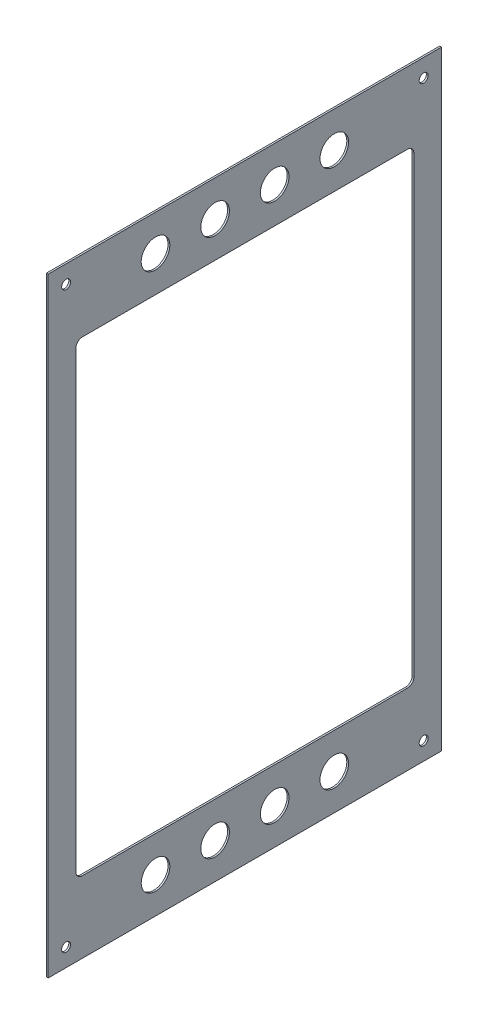
from build123d import *

# Parameters (mm, degrees)
SKETCH1_W           = 341
SKETCH1_H           = 220
BOSS_EXTRUDE1_DEPTH = 1
SKETCH2_R           = 8
CUT_EXTRUDE1_DEPTH  = 203.906998401
SKETCH3_R           = 2.5
CUT_EXTRUDE2_DEPTH  = 203.906998401


with BuildPart() as part:
    # Sketch1 → Boss-Extrude1 (new body)
    with BuildSketch(Plane.YZ):
        Rectangle(SKETCH1_W, SKETCH1_H)
    extrude(amount=BOSS_EXTRUDE1_DEPTH)

    # Sketch2 → Cut-Extrude1 (cut, through all)
    with BuildSketch(Plane.YZ.offset(1)):
        with Locations((150.50261802, 50)):
            Circle(SKETCH2_R)
        with Locations((150.50261802, 16.67)):
            Circle(SKETCH2_R)
        with Locations((150.50261802, -16.67)):
            Circle(SKETCH2_R)
        with Locations((150.50261802, -50)):
            Circle(SKETCH2_R)
        with Locations((-150.50261802, -50)):
            Circle(SKETCH2_R)
        with Locations((-150.50261802, -16.67)):
            Circle(SKETCH2_R)
        with Locations((-150.50261802, 16.67)):
            Circle(SKETCH2_R)
        with Locations((-150.50261802, 50)):
            Circle(SKETCH2_R)
        with BuildLine():
            Line((-130.50261802, 91.002659242), (-130.502618018, -91.002659141))
            ThreePointArc((-130.502618018, -91.002659141), (-129.477508731, -93.477508839), (-127.002658987, -94.502618015))
            Line((-127.002658987, -94.502618015), (127.002659141, -94.502618018))
            ThreePointArc((127.002659141, -94.502618018), (129.477508787, -93.477508786), (130.50261802, -91.002659141))
            Line((130.50261802, -91.002659141), (130.502618017, 91.002659141))
            ThreePointArc((130.502618017, 91.002659141), (129.477508731, 93.477508839), (127.002658987, 94.502618015))
            Line((127.002658987, 94.502618015), (-127.00265914, 94.502618018))
            ThreePointArc((-127.00265914, 94.502618018), (-129.477508751, 93.477508822), (-130.50261802, 91.002659242))
        make_face()
    extrude(amount=-CUT_EXTRUDE1_DEPTH, mode=Mode.SUBTRACT)

    # Sketch3 → Cut-Extrude2 (cut, through all)
    with BuildSketch(Plane.YZ.offset(1)):
        with Locations((-160.5, 100)):
            Circle(SKETCH3_R)
        with Locations((160.5, 100)):
            Circle(SKETCH3_R)
        with Locations((-160.5, -100)):
            Circle(SKETCH3_R)
        with Locations((160.5, -100)):
            Circle(SKETCH3_R)
    extrude(amount=-CUT_EXTRUDE2_DEPTH, mode=Mode.SUBTRACT)


solid = part.part
